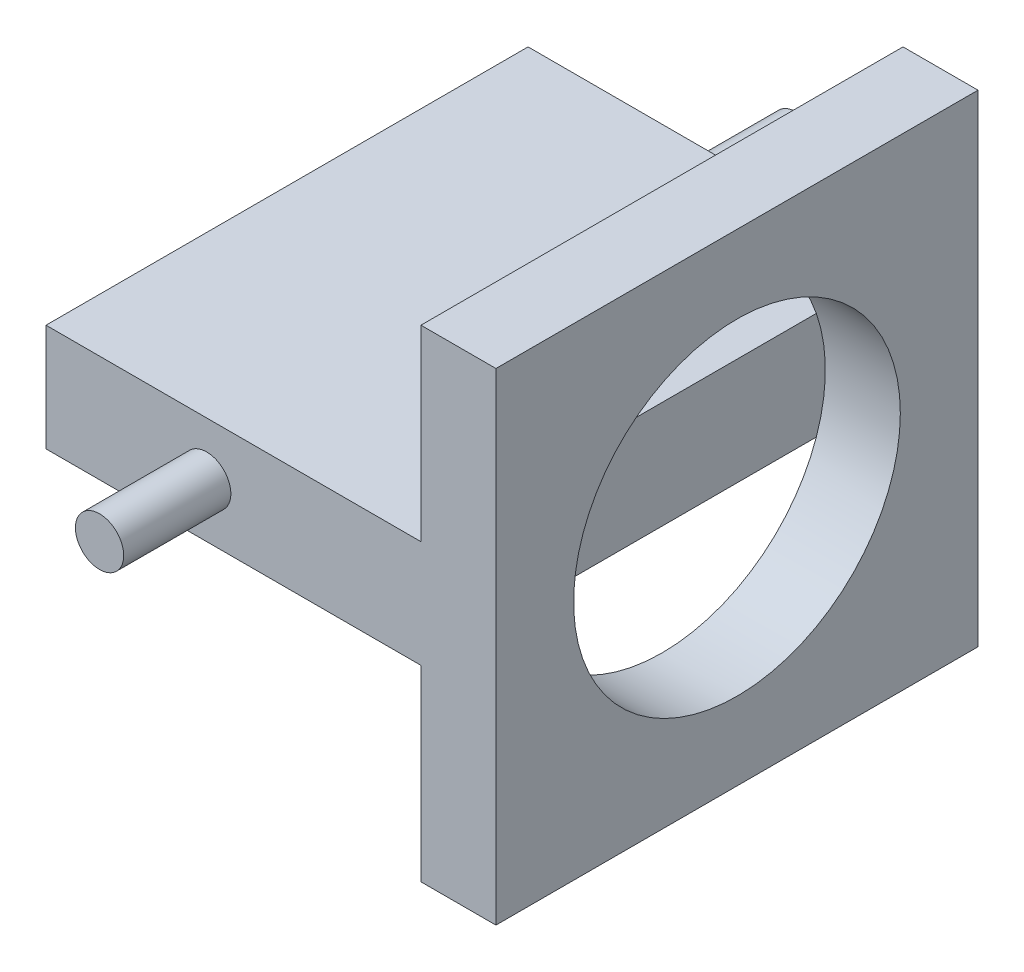
from build123d import *

# Parameters (mm, degrees)
SKETCH1_W           = 45
SKETCH1_H           = 45
SKETCH1_R           = 15.25
BOSS_EXTRUDE1_DEPTH = 7
SKETCH2_W           = 45
SKETCH2_H           = 10
BOSS_EXTRUDE2_DEPTH = 35
SKETCH3_R           = 2.254428588
BOSS_EXTRUDE3_DEPTH = 10


with BuildPart() as part:
    # Sketch1 → Boss-Extrude1 (new body)
    with BuildSketch(Plane(origin=(0, 0, 0), x_dir=(0, 0, -1), z_dir=(1, 0, 0))):
        Rectangle(SKETCH1_W, SKETCH1_H)
        Circle(SKETCH1_R, mode=Mode.SUBTRACT)
    extrude(amount=BOSS_EXTRUDE1_DEPTH)

    # Sketch2 → Boss-Extrude2 (add)
    with BuildSketch(Plane.ZY):
        Rectangle(SKETCH2_W, SKETCH2_H)
    extrude(amount=BOSS_EXTRUDE2_DEPTH)

    # Sketch3 → Boss-Extrude3 (add)
    with BuildSketch(Plane.XY.offset(22.5)):
        with Locations((-20, 0)):
            Circle(SKETCH3_R)
    boss_extrude3 = extrude(amount=BOSS_EXTRUDE3_DEPTH)

    # Mirror1: Boss-Extrude3 across plane
    add(boss_extrude3.mirror(Plane.XY))


solid = part.part
